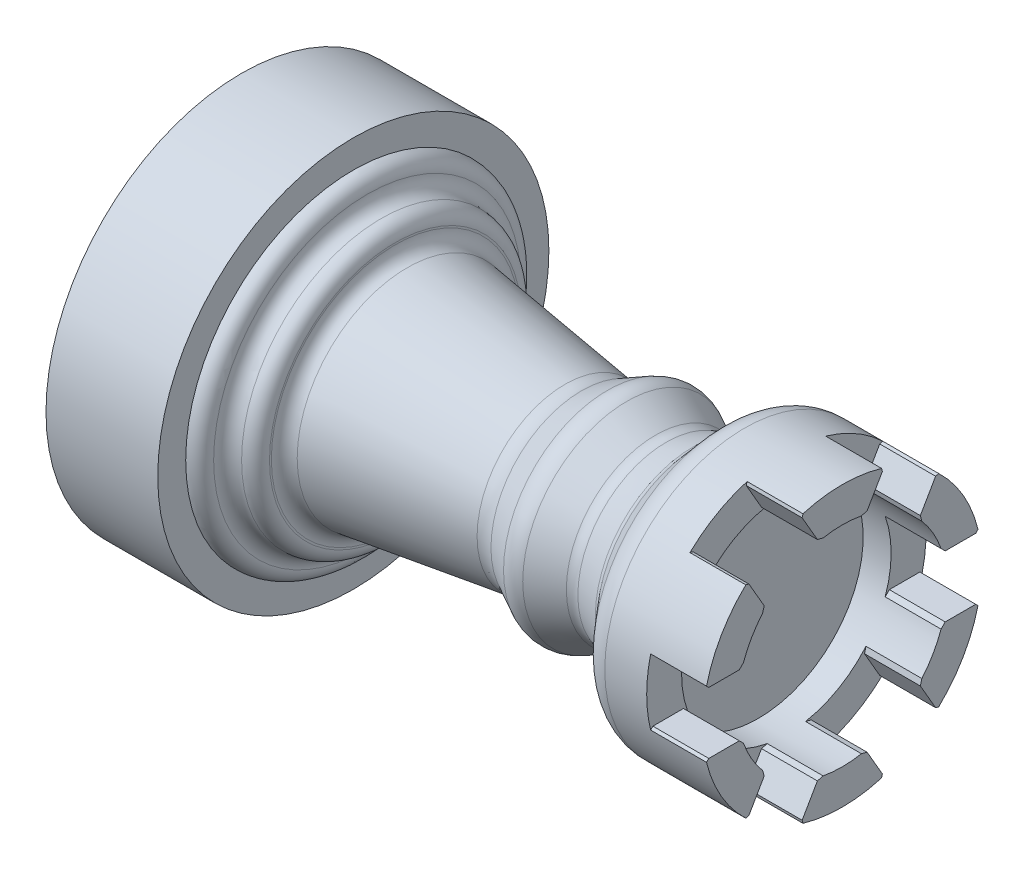
from build123d import *

# Parameters (mm, degrees)
ESBO_O2_W             = 12.3
ESBO_O2_H             = 2.2
CORTE_EXTRUS_O1_DEPTH = 2
FILETE3_R             = 0.5
FILETE4_R             = 0.5
CHANFRO1_SIZE         = 0.35
FILETE5_R             = 0.75
PADR_OCIRCULAR1_COUNT = 3
FILETE6_R             = 1
CHANFRO2_SIZE         = 0.1
SKETCH1_R             = 7
BOSS_EXTRUDE1_DEPTH   = 2.5
BOSS_EXTRUDE2_START   = 1.5
SKETCH1_2_R           = 7
BOSS_EXTRUDE2_DEPTH   = 1.5
SKETCH3_R             = 6.05
CUT_EXTRUDE1_DEPTH    = 3.2


# Some blends are built 0.0001 mm under size
with BuildPart() as part:
    # Esboço1 → Revolução1 (revolve)
    with BuildSketch(Plane.XY, mode=Mode.PRIVATE) as revolu_o1_sk:
        with BuildLine():
            Line((3, 5), (4, 5))
            Line((4, 5), (4, 4))
            Line((4, 4), (10.388685706, 3.099916747))
            Line((10.388685706, 3.099916747), (11.944342853, 3.901984746))
            Line((11.944342853, 3.901984746), (13.5, 3.099916747))
            ThreePointArc((13.5, 3.099916747), (14.139882416, 3.307702721), (14.772414141, 3.536892893))
            Line((14.772414141, 3.536892893), (15.74529042, 4.656059029))
            ThreePointArc((15.74529042, 4.656059029), (16.085306757, 4.909961271), (16.5, 5))
            Line((16.5, 5), (20, 5))
            Line((20, 5), (20, 3.75))
            Line((20, 3.75), (17, 3.75))
            Line((17, 3.75), (17, 0))
            Line((17, 0), (0, 0))
            Line((0, 0), (0, 6))
            Line((0, 6), (3, 6))
            Line((3, 6), (3, 5))
        make_face()
    revolve(revolu_o1_sk.sketch.rotate(Axis((0, 0, 0), (1, 0, 0)), 90), axis=Axis((0, 0, 0), (1, 0, 0)))

    # Esboço2 → Corte-extrusão1 (cut)
    with BuildSketch(Plane(origin=(20, 0, 0), x_dir=(0, 0, -1), z_dir=(1, 0, 0))):
        Rectangle(ESBO_O2_W, ESBO_O2_H)
    corte_extrus_o1 = extrude(amount=-CORTE_EXTRUS_O1_DEPTH, mode=Mode.SUBTRACT)

    # Filete3
    filete3_edges = [part.edges().sort_by_distance(p)[0] for p in [
        (3, 0, -5),
        (4, 0, -4),
        (13.5, 0, -3.099916747),
        (14.772414141, 0, -3.536892893),
    ]]
    fillet(filete3_edges, radius=FILETE3_R)

    # Filete4
    filete4_edges = [part.edges().sort_by_distance(p)[0] for p in [
        (3, 0, -6),
        (4, 0, -5),
    ]]
    fillet(filete4_edges, radius=FILETE4_R - 0.0001)  # a hair under: the kernel refuses the full size

    # Chanfro1
    chanfro1_edges = [part.edges().sort_by_distance(p)[0] for p in [
        (0, 0, -6),
    ]]
    chamfer(chanfro1_edges, length=CHANFRO1_SIZE)

    # Filete5
    filete5_edges = [part.edges().sort_by_distance(p)[0] for p in [
        (11.944342853, 0, -3.901984746),
    ]]
    fillet(filete5_edges, radius=FILETE5_R)

    # PadrãoCircular1: Corte-extrusão1 ×3 about axis
    padr_ocircular1_axis = Axis((0, 0, 0), (1, 0, 0))
    for i in range(1, PADR_OCIRCULAR1_COUNT):
        add(corte_extrus_o1.rotate(padr_ocircular1_axis, i * 360 / PADR_OCIRCULAR1_COUNT), mode=Mode.SUBTRACT)

    # Filete6
    filete6_edges = [part.edges().sort_by_distance(p)[0] for p in [
        (10.388685706, 0, -3.099916747),
    ]]
    fillet(filete6_edges, radius=FILETE6_R)

    # Chanfro2
    # the kernel refuses this chamfer: 0.150903104, 0.1, 0.083647019 mm, written as the material it takes off along each edge
    with BuildSketch(Plane(origin=(18, -3.674038352, 3.391377624), x_dir=(0, 0.6843665463498617, 0.7291381420808835), z_dir=(1, 0, 0)), Plane(origin=(18, 3.674038352, -3.391377624), x_dir=(0, -0.6843665463498592, -0.7291381420808858), z_dir=(1, 0, 0)), Plane(origin=(18, -1.1, -4.877499359), x_dir=(0, -0.9736354270851664, 0.2281097435987456), z_dir=(1, 0, 0)), Plane(origin=(18, 1.1, 4.877499359), x_dir=(0, 0.9736354270851673, -0.22810974359874206), z_dir=(1, 0, 0)), Plane(origin=(18, -4.774038352, -1.486121735), x_dir=(0, -0.2892688807353101, 0.95724788567964), z_dir=(1, 0, 0)), Plane(origin=(18, 4.774038352, 1.486121735), x_dir=(0, 0.28926888073530843, -0.9572478856796405), z_dir=(1, 0, 0))) as chanfro2_piece_1:
        with BuildLine():
            Line((0.083212317, 0), (CHANFRO2_SIZE * 0.228109743599, -CHANFRO2_SIZE * 0.973635427085))
            Line((CHANFRO2_SIZE * 0.228109743599, -CHANFRO2_SIZE * 0.973635427085), (0, 0))
            ThreePointArc((0, 0), (0.042660169, 0.000172999), (0.083212317, 0))
        make_face()
    extrude(amount=2.257168299, mode=Mode.SUBTRACT)
    with BuildSketch(Plane(origin=(18, -4.774038352, 1.486121735), x_dir=(0, -0.28926888073530255, -0.9572478856796423), z_dir=(1, 0, 0)), Plane(origin=(18, 4.774038352, -1.486121735), x_dir=(0, 0.28926888073529794, 0.9572478856796437), z_dir=(1, 0, 0)), Plane(origin=(18, 1.1, -4.877499359), x_dir=(0, 0.9736354270851638, 0.22810974359875694), z_dir=(1, 0, 0)), Plane(origin=(18, -1.1, 4.877499359), x_dir=(0, -0.9736354270851638, -0.22810974359875694), z_dir=(1, 0, 0)), Plane(origin=(18, -3.674038352, -3.391377624), x_dir=(0, 0.684366546349859, -0.7291381420808859), z_dir=(1, 0, 0)), Plane(origin=(18, 3.674038352, 3.391377624), x_dir=(0, -0.6843665463498564, 0.7291381420808885), z_dir=(1, 0, 0))) as chanfro2_piece_2:
        with BuildLine():
            Line((0.083212317, 0), (CHANFRO2_SIZE * 0.228109743599, CHANFRO2_SIZE * 0.973635427085))
            Line((CHANFRO2_SIZE * 0.228109743599, CHANFRO2_SIZE * 0.973635427085), (0, 0))
            ThreePointArc((0, 0), (0.042660169, -0.000172999), (0.083212317, 0))
        make_face()
    extrude(amount=2.257168299, mode=Mode.SUBTRACT)
    with BuildSketch(Plane(origin=(20.406395934, -3.654734288, 0.839891233), x_dir=(0, -0.8660254037844374, 0.5000000000000021), z_dir=(-1, 0, 0)), Plane(origin=(20.406395934, 3.654734288, -0.839891233), x_dir=(0, 0.8660254037844374, -0.5000000000000021), z_dir=(-1, 0, 0)), Plane(origin=(20.406395934, 2.554734288, 2.745147121), x_dir=(0, 0.8660254037844372, 0.5000000000000027), z_dir=(-1, 0, 0)), Plane(origin=(20.406395934, -2.554734288, -2.745147121), x_dir=(0, -0.8660254037844384, -0.5000000000000008), z_dir=(-1, 0, 0)), Plane(origin=(20.406395934, 1.1, -3.585038354), x_dir=(0, 0, -1), z_dir=(-1, 0, 0)), Plane(origin=(20.406395934, -1.1, 3.585038354), x_dir=(0, 0, 1), z_dir=(-1, 0, 0))) as chanfro2_piece_3:
        with BuildLine():
            Line((CHANFRO2_SIZE, 0), (-0.049233566, -0.149233566))
            ThreePointArc((-0.049233566, -0.149233566), (-0.024680823, -0.077435456), (0, 0))
            Line((0, 0), (CHANFRO2_SIZE, 0))
        make_face()
    extrude(amount=2.406395934, mode=Mode.SUBTRACT)
    with BuildSketch(Plane(origin=(20.406395934, -2.554734288, 2.745147121), x_dir=(0, -0.8660254037844393, 0.4999999999999987), z_dir=(-1, 0, 0)), Plane(origin=(20.406395934, 2.554734288, -2.745147121), x_dir=(0, 0.8660254037844384, -0.5000000000000008), z_dir=(-1, 0, 0)), Plane(origin=(20.406395934, 3.654734288, 0.839891233), x_dir=(0, 0.8660254037844396, 0.4999999999999983), z_dir=(-1, 0, 0)), Plane(origin=(20.406395934, -3.654734288, -0.839891233), x_dir=(0, -0.8660254037844387, -0.49999999999999983), z_dir=(-1, 0, 0)), Plane(origin=(20.406395934, 1.1, 3.585038354), x_dir=(0, 0, 1), z_dir=(-1, 0, 0)), Plane(origin=(20.406395934, -1.1, -3.585038354), x_dir=(0, 0, -1), z_dir=(-1, 0, 0))) as chanfro2_piece_4:
        with BuildLine():
            Line((CHANFRO2_SIZE, 0), (-0.049233566, 0.149233566))
            ThreePointArc((-0.049233566, 0.149233566), (-0.024680823, 0.077435456), (0, 0))
            Line((0, 0), (CHANFRO2_SIZE, 0))
        make_face()
    extrude(amount=2.406395934, mode=Mode.SUBTRACT)

    # Sketch1 → Boss-Extrude1 (add)
    with BuildSketch(Plane.ZY):
        Circle(SKETCH1_R)
    extrude(amount=-BOSS_EXTRUDE1_DEPTH)

    # Sketch1<2> → Boss-Extrude2 (add)
    with BuildSketch(Plane.ZY.offset(BOSS_EXTRUDE2_START)):
        Circle(SKETCH1_2_R)
    extrude(amount=-BOSS_EXTRUDE2_DEPTH)

    # Sketch3 → Cut-Extrude1 (cut)
    with BuildSketch(Plane.ZY.offset(1.5)):
        Circle(SKETCH3_R)
    extrude(amount=-CUT_EXTRUDE1_DEPTH, mode=Mode.SUBTRACT)


solid = part.part
